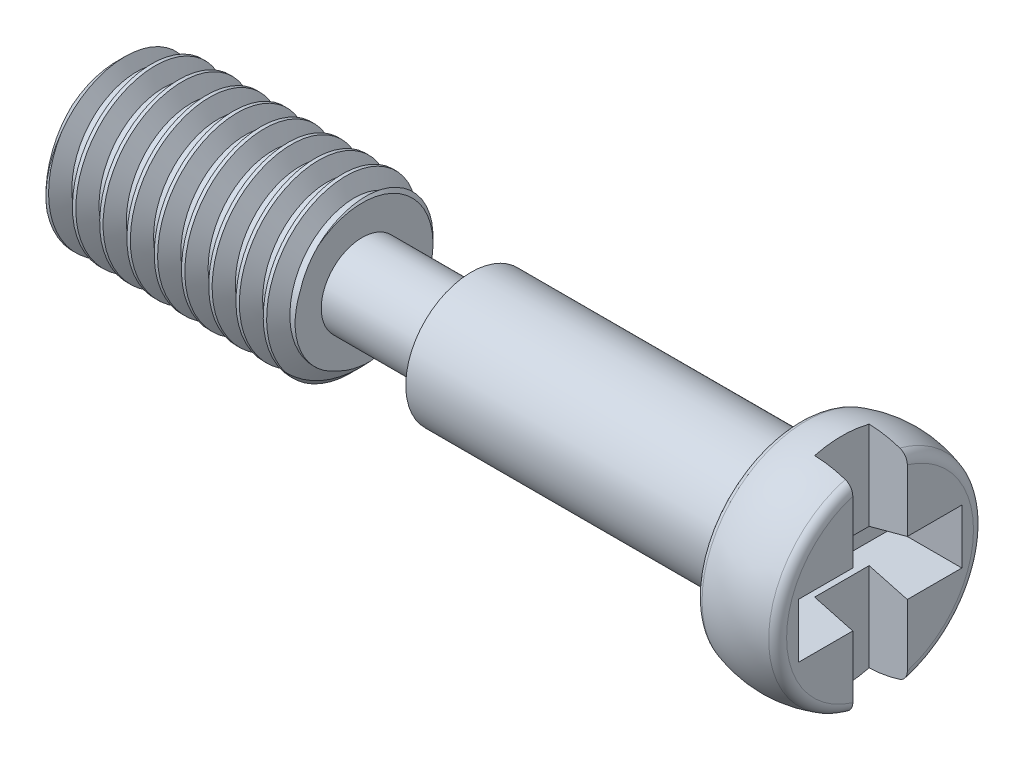
from build123d import *

# Parameters (mm, degrees)
M3THREAD_PITCH     = 0.5
SKETCH2_W          = 3
SKETCH2_H          = 1
CUT_EXTRUDE1_DEPTH = 1
CUT_EXTRUDE1_DRAFT = -15
SKETCH2_3_W        = 1
SKETCH2_3_H        = 1
CUT_EXTRUDE2_DEPTH = 0.7


with BuildPart() as part:
    # Sketch1 → Body (revolve)
    with BuildSketch(Plane.XY, mode=Mode.PRIVATE) as body_sk:
        with BuildLine():
            Line((0, 0), (0, 1.3))
            Line((0, 1.3), (0.2, 1.5))
            Line((0.2, 1.5), (4.3, 1.5))
            Line((4.3, 1.5), (4.5, 1.3))
            Line((4.5, 1.3), (4.5, 0.75))
            Line((4.5, 0.75), (6.5, 0.75))
            Line((6.5, 0.75), (6.5, 1.2))
            Line((6.5, 1.2), (12.5, 1.2))
            Line((12.5, 1.2), (12.5, 1.71391365))
            ThreePointArc((12.5, 1.71391365), (12.538410671, 1.83176478), (12.638888889, 1.9043485))
            ThreePointArc((12.638888889, 1.9043485), (13.25, 2), (13.861111111, 1.9043485))
            ThreePointArc((13.861111111, 1.9043485), (13.961589329, 1.83176478), (14, 1.71391365))
            Line((14, 1.71391365), (14, 0))
            Line((14, 0), (0, 0))
        make_face()
    revolve(body_sk.sketch.rotate(Axis((0, 0, 0), (-1, 0, 0)), 90), axis=Axis((0, 0, 0), (-1, 0, 0)))

    # M3Thread: the profile of Thread Profile1 profile screwed along a right-hand helix of 12 turns, 6 arcs to a turn; built about Z, then put on its axis
    m3thread_z = Axis((0, 0, 0), (0, 0, 1))
    m3thread_corners = [(1.5003, 0, -0.000173205), (1.5003, 0, 0.437673204), (1.229367063, 0, 0.281249999), (1.229367062, 0, 0.156249999)]
    with BuildLine(mode=Mode.PRIVATE) as m3thread_profile:
        Line(m3thread_corners[0], m3thread_corners[1])
        Line(m3thread_corners[1], m3thread_corners[2])
        Line(m3thread_corners[2], m3thread_corners[3])
        Line(m3thread_corners[3], m3thread_corners[0])
    m3thread_cap = Face(m3thread_profile.wire())
    m3thread_turn_angles = [0, 30, 60, 90, 120, 150, 180, 210, 240, 270, 300, 330, 360]
    m3thread_turn_weights = [1, 0.8660254037844387, 1, 0.8660254037844387, 1, 0.8660254037844387, 1, 0.8660254037844387, 1, 0.8660254037844387, 1, 0.8660254037844387, 1]
    m3thread_turn_rails = [Edge.make_bspline([Vector(p[0], p[1], 0).rotate(m3thread_z, m3thread_turn_angles[k]) / m3thread_turn_weights[k] + Vector(0, 0, p[2] + M3THREAD_PITCH * m3thread_turn_angles[k] / 360) for k in range(13)], [0, 0, 0, 1, 1, 2, 2, 3, 3, 4, 4, 5, 5, 6, 6, 6], 2, m3thread_turn_weights) for p in m3thread_corners]
    m3thread_turn_sides = [Face.make_surface_from_curves(m3thread_turn_rails[p[0]], m3thread_turn_rails[p[1]]) for p in [(0, 1), (1, 2), (2, 3), (3, 0)]]
    m3thread = Plane(origin=(-1, 0, 0), x_dir=(0, 0, -1), z_dir=(1, 0, 0)) * Solid(Shell([*[p.moved(Location((0, 0, M3THREAD_PITCH * i))) for i in range(12) for p in m3thread_turn_sides], m3thread_cap, m3thread_cap.rotate(m3thread_z, 4320).moved(Location((0, 0, M3THREAD_PITCH * 4320 / 360)))]))
    add(m3thread, mode=Mode.SUBTRACT)


with BuildPart() as cut_extrude1_tool:
    # Sketch2 → Cut-Extrude1 (with draft: the straight prism first)
    with BuildSketch(Plane(origin=(14, 0, 0), x_dir=(0, 0, -1), z_dir=(1, 0, 0))):
        Rectangle(SKETCH2_W, SKETCH2_H)
    extrude(amount=-CUT_EXTRUDE1_DEPTH)
    # Cut-Extrude1: the draft: its side faces are tilted about the plane it starts from
    cut_extrude1_sides = [cut_extrude1_tool.faces().sort_by_distance(p)[0] for p in [
        (13.5, 0.5, 0),
        (13.5, 0, 1.5),
        (13.5, -0.5, 0),
        (13.5, 0, -1.5),
    ]]
    draft(cut_extrude1_sides, Plane(origin=(14, 0, 0), x_dir=(0, 0, -1), z_dir=(1, 0, 0)), CUT_EXTRUDE1_DRAFT)


with BuildPart() as part_1:
    add(part.part)

    # Cut-Extrude1: cut by cut_extrude1_tool
    add(cut_extrude1_tool.part, mode=Mode.SUBTRACT)

    # Sketch2<3> → Cut-Extrude2 (cut)
    with BuildSketch(Plane(origin=(14, 0, 0), x_dir=(0, 0, -1), z_dir=(1, 0, 0))):
        with BuildLine():
            ThreePointArc((0.5, 1.639359631), (0, 1.71391365), (-0.5, 1.639359631))
            Line((-0.5, 1.639359631), (-0.5, 0.5))
            Line((-0.5, 0.5), (0.5, 0.5))
            Line((0.5, 0.5), (0.5, 1.639359631))
        make_face()
        Rectangle(SKETCH2_3_W, SKETCH2_3_H)
        with BuildLine():
            ThreePointArc((-0.5, -1.639359631), (0, -1.71391365), (0.5, -1.639359631))
            Line((0.5, -1.639359631), (0.5, -0.5))
            Line((0.5, -0.5), (-0.5, -0.5))
            Line((-0.5, -0.5), (-0.5, -1.639359631))
        make_face()
        with BuildLine():
            Line((-0.5, 2.064000966), (-0.5, 1.639359631))
            ThreePointArc((-0.5, 1.639359631), (0, 1.71391365), (0.5, 1.639359631))
            Line((0.5, 1.639359631), (0.5, 2.064000966))
            Line((0.5, 2.064000966), (-0.5, 2.064000966))
        make_face()
        with BuildLine():
            Line((-0.5, -2.064000966), (0.5, -2.064000966))
            Line((0.5, -2.064000966), (0.5, -1.639359631))
            ThreePointArc((0.5, -1.639359631), (0, -1.71391365), (-0.5, -1.639359631))
            Line((-0.5, -1.639359631), (-0.5, -2.064000966))
        make_face()
    extrude(amount=-CUT_EXTRUDE2_DEPTH, mode=Mode.SUBTRACT)


solid = part_1.part
